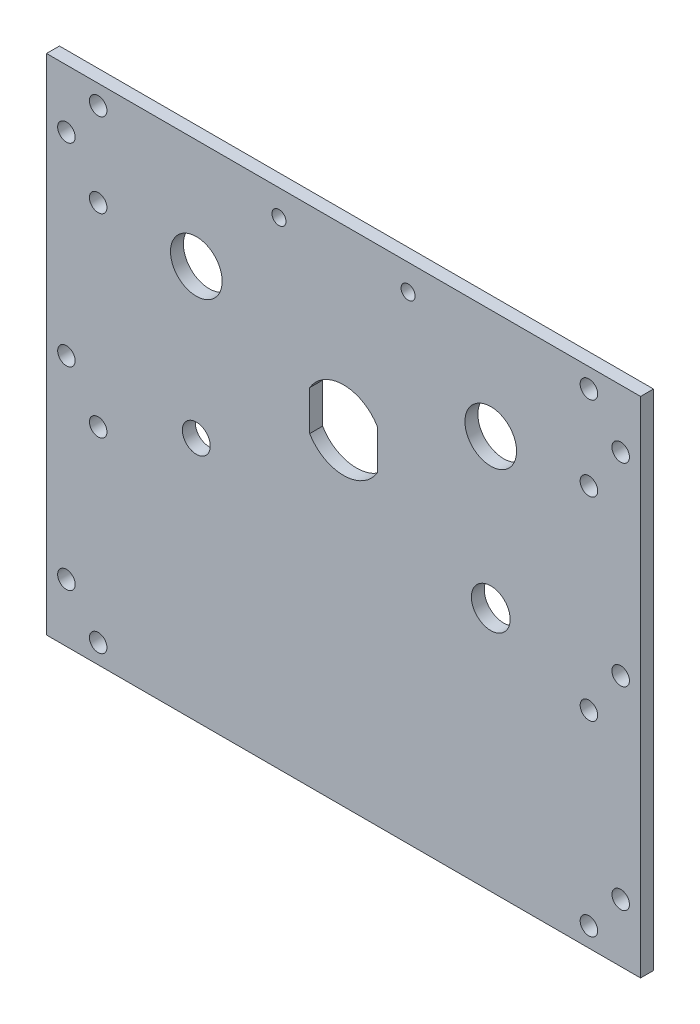
from build123d import *

# Parameters (mm, degrees)
SKETCH1_W             = 146.05
SKETCH1_H             = 123.825
BOSS_EXTRUDE1_DEPTH   = 3.175
F_6_CLEARANCE_HOLE1_D = 4.3053
SKETCH4_R             = 6.35
SKETCH4_R_2           = 4.7625
SKETCH4_R_3           = 3.429
CUT_EXTRUDE1_DEPTH    = 192.502777395
F_4_CLEARANCE_HOLE1_D = 3.4544


with BuildPart() as part:
    # Sketch1 → Boss-Extrude1 (new body)
    with BuildSketch(Plane.XY):
        with Locations((-73.025, 61.9125)):
            Rectangle(SKETCH1_W, SKETCH1_H)
    extrude(amount=-BOSS_EXTRUDE1_DEPTH)

    # #6 Clearance Hole1 (through all)
    with Locations(Plane(origin=(0, 0, -3.175), x_dir=(-1, 0, 0), z_dir=(0, 0, -1))):
        with Locations((12.7, 119.0625), (133.35, 119.0625), (141.1605, 109.5375), (133.35, 98.425), (141.1605, 61.9125), (133.35, 50.673), (133.35, 4.7625), (12.7, 4.7625), (12.7, 50.673), (12.7, 98.425), (4.8895, 109.5375), (141.1605, 14.2875), (4.8895, 14.2875), (4.8895, 61.9125)):
            Hole(F_6_CLEARANCE_HOLE1_D / 2)

    # Sketch4 → Cut-Extrude1 (cut, through all)
    with BuildSketch(Plane(origin=(0, 0, -3.175), x_dir=(-1, 0, 0), z_dir=(0, 0, -1))):
        with Locations((36.83, 96.901)):
            Circle(SKETCH4_R)
        with Locations((36.83, 60.325)):
            Circle(SKETCH4_R_2)
        with Locations((109.22, 60.325)):
            Circle(SKETCH4_R_3)
        with Locations((109.22, 96.901)):
            Circle(SKETCH4_R)
        with BuildLine():
            Line((81.3435, 85.032269324), (81.3435, 75.241730676))
            ThreePointArc((81.3435, 75.241730676), (73.025, 70.485), (64.7065, 75.241730676))
            Line((64.7065, 75.241730676), (64.7065, 85.032269324))
            ThreePointArc((64.7065, 85.032269324), (73.025, 89.789), (81.3435, 85.032269324))
        make_face()
    extrude(amount=-CUT_EXTRUDE1_DEPTH, mode=Mode.SUBTRACT)

    # #4 Clearance Hole1 (through all)
    with Locations(Plane.XY):
        with Locations((-88.9, 117.475), (-57.15, 117.475)):
            Hole(F_4_CLEARANCE_HOLE1_D / 2)


solid = part.part
